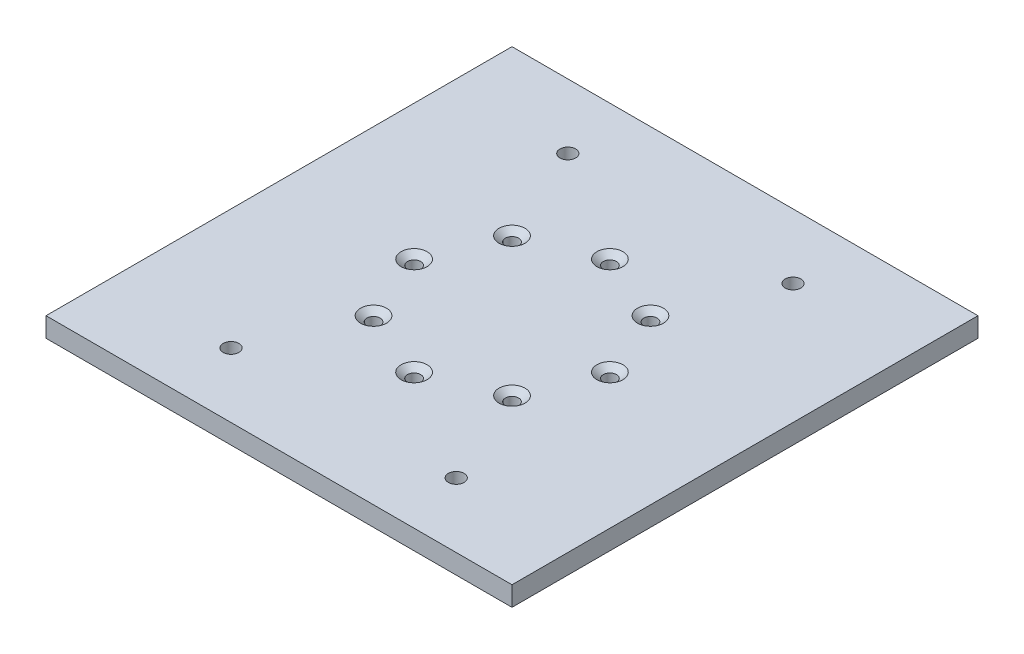
from build123d import *

# Parameters (mm, degrees)
SKETCH1_W                                         = 151.13
SKETCH1_H                                         = 151.13
BOSS_EXTRUDE1_DEPTH                               = 6.35
F_7_0_201_DIAMETER_HOLE1_D                        = 5.1054
CIRPATTERN1_COUNT                                 = 2
CSK_FOR_8_FLAT_HEAD_MACHINE_SCREW_100_D           = 4.3053
CSK_FOR_8_FLAT_HEAD_MACHINE_SCREW_100_CSINK_D     = 8.4328
CSK_FOR_8_FLAT_HEAD_MACHINE_SCREW_100_CSINK_ANGLE = 100
CIRPATTERN2_COUNT                                 = 8


with BuildPart() as part:
    # Sketch1 → Boss-Extrude1 (new body)
    with BuildSketch(Plane(origin=(0, 0, 0), x_dir=(1, 0, 0), z_dir=(0, 1, 0))):
        Rectangle(SKETCH1_W, SKETCH1_H)
    extrude(amount=BOSS_EXTRUDE1_DEPTH)

    # #7 (0.201) Diameter Hole1 (through all)
    with Locations(Plane(origin=(0, 6.35, 0), x_dir=(-1, 0, 0), z_dir=(0, 1, 0))):
        with Locations((36.5125, -54.61), (-36.5125, -54.61)):
            f_7_0_201_diameter_hole1 = Hole(F_7_0_201_DIAMETER_HOLE1_D / 2)

    # CirPattern1: #7 (0.201) Diameter Hole1 ×2 about axis
    cirpattern1_axis = Axis((0, 0, 0), (0, 1, 0))
    for i in range(1, CIRPATTERN1_COUNT):
        add(f_7_0_201_diameter_hole1.rotate(cirpattern1_axis, i * 360 / CIRPATTERN1_COUNT), mode=Mode.SUBTRACT)

    # CSK for #8 Flat Head Machine Screw (100)1 (through all)
    with Locations(Plane(origin=(0, 6.35, 0), x_dir=(-1, 0, 0), z_dir=(0, 1, 0))):
        with Locations((0, 31.75)):
            csk_for_8_flat_head_machine_screw_100 = CounterSinkHole(CSK_FOR_8_FLAT_HEAD_MACHINE_SCREW_100_D / 2, CSK_FOR_8_FLAT_HEAD_MACHINE_SCREW_100_CSINK_D / 2, counter_sink_angle=CSK_FOR_8_FLAT_HEAD_MACHINE_SCREW_100_CSINK_ANGLE)

    # CirPattern2: CSK for #8 Flat Head Machine Screw (100)1 ×8 about axis
    cirpattern2_axis = Axis((0, 0, 0), (0, 1, 0))
    for i in range(1, CIRPATTERN2_COUNT):
        add(csk_for_8_flat_head_machine_screw_100.rotate(cirpattern2_axis, i * 360 / CIRPATTERN2_COUNT), mode=Mode.SUBTRACT)


solid = part.part
